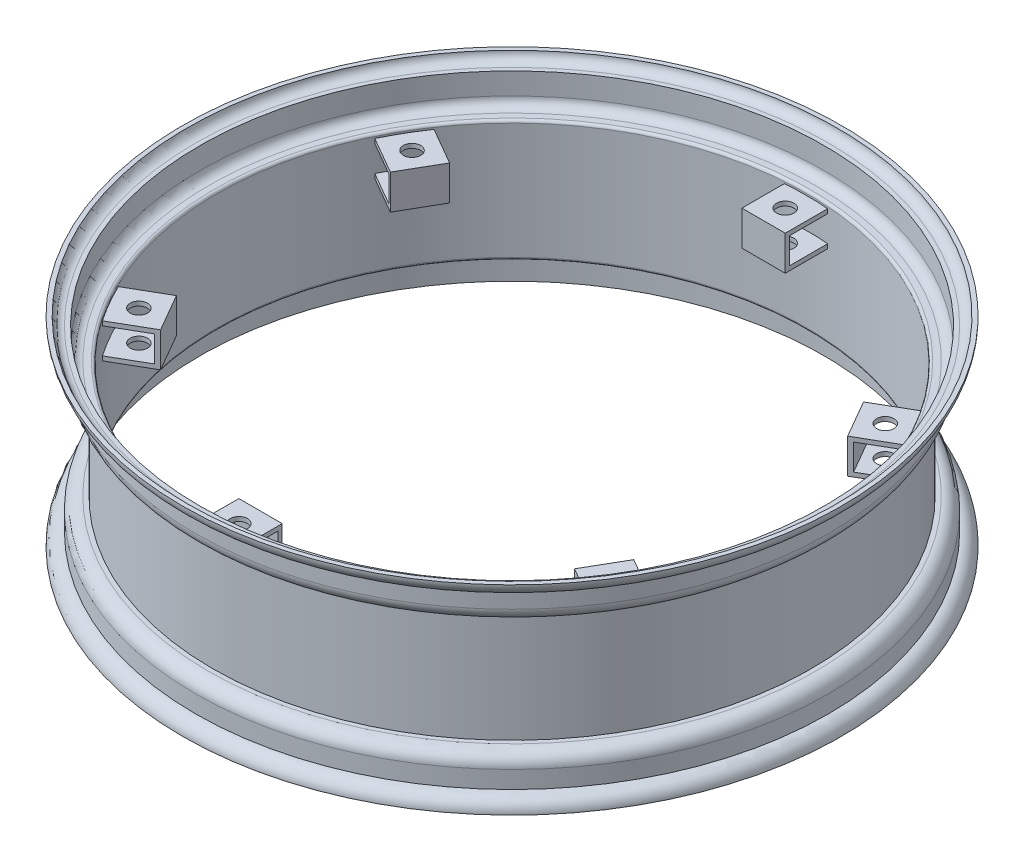
from build123d import *

# Parameters (mm, degrees)
THICKEN2_START     = -25
THICKEN2_DEPTH     = 50
SKETCH4_R          = 10
CUT_EXTRUDE1_DEPTH = 50
CIRPATTERN1_COUNT  = 6


# Read off the part's stored shape, not the designer's step: Thicken2
with BuildPart() as part:
    # Sketch1 → Revolve1 (revolve)
    with BuildSketch(Plane.XY, mode=Mode.PRIVATE) as revolve1_sk:
        with BuildLine():
            Line((-340, -67), (-340, 67))
            ThreePointArc((-340, 67), (-340.878679656, 69.121320344), (-343, 70))
            Line((-343, 70), (-350, 70))
            ThreePointArc((-350, 70), (-357.071067812, 72.928932188), (-360, 80))
            Line((-360, 80), (-360, 105))
            Line((-360, 105), (-365, 105))
            ThreePointArc((-365, 105), (-372.071067812, 107.928932188), (-375, 115))
            Line((-375, 115), (-380, 115))
            ThreePointArc((-380, 115), (-375.606601718, 104.393398282), (-365, 100))
            Line((-365, 100), (-365, 80))
            ThreePointArc((-365, 80), (-360.606601718, 69.393398282), (-350, 65))
            Line((-350, 65), (-345, 65))
            Line((-345, 65), (-345, -65))
            Line((-345, -65), (-350, -65))
            ThreePointArc((-350, -65), (-360.606601718, -69.393398282), (-365, -80))
            Line((-365, -80), (-365, -100))
            ThreePointArc((-365, -100), (-375.606601718, -104.393398282), (-380, -115))
            Line((-380, -115), (-375, -115))
            ThreePointArc((-375, -115), (-372.071067812, -107.928932188), (-365, -105))
            Line((-365, -105), (-360, -105))
            Line((-360, -105), (-360, -80))
            ThreePointArc((-360, -80), (-357.071067812, -72.928932188), (-350, -70))
            Line((-350, -70), (-343, -70))
            ThreePointArc((-343, -70), (-340.878679656, -69.121320344), (-340, -67))
        make_face()
    revolve(revolve1_sk.sketch.rotate(Axis((0, 144.436090226, 0), (0, -1, 0)), 270), axis=Axis((0, 144.436090226, 0), (0, -1, 0)))


with BuildPart() as body_2:
    # Thicken2 outline → Thicken2 (new body)
    with BuildSketch(Plane.YZ.offset(THICKEN2_START)):
        Polygon((25, -290), (25, -340), (30, -340), (30, -295), (60, -295), (60, -340), (65, -340), (65, -290), align=None)
    thicken2 = extrude(amount=THICKEN2_DEPTH)

    # Sketch4 → Cut-Extrude1 (cut)
    with BuildSketch(Plane(origin=(0, 65, 0), x_dir=(1, 0, 0), z_dir=(0, 1, 0))):
        with Locations(Location((0, 315, 0), (0, 0, 90))):
            Circle(SKETCH4_R)
    cut_extrude1 = extrude(amount=-CUT_EXTRUDE1_DEPTH, mode=Mode.SUBTRACT)


with BuildPart() as part_1:
    add(part.part)

    # CirPattern1: Thicken2, Cut-Extrude1 ×6 about axis
    cirpattern1_axis = Axis((0, 0, 0), (0, 1, 0))
    add([thicken2.rotate(cirpattern1_axis, i * 360 / CIRPATTERN1_COUNT) for i in range(1, CIRPATTERN1_COUNT)])
    add([cut_extrude1.rotate(cirpattern1_axis, i * 360 / CIRPATTERN1_COUNT) for i in range(1, CIRPATTERN1_COUNT)], mode=Mode.SUBTRACT)


solid = Compound([body_2.part, part_1.part])
